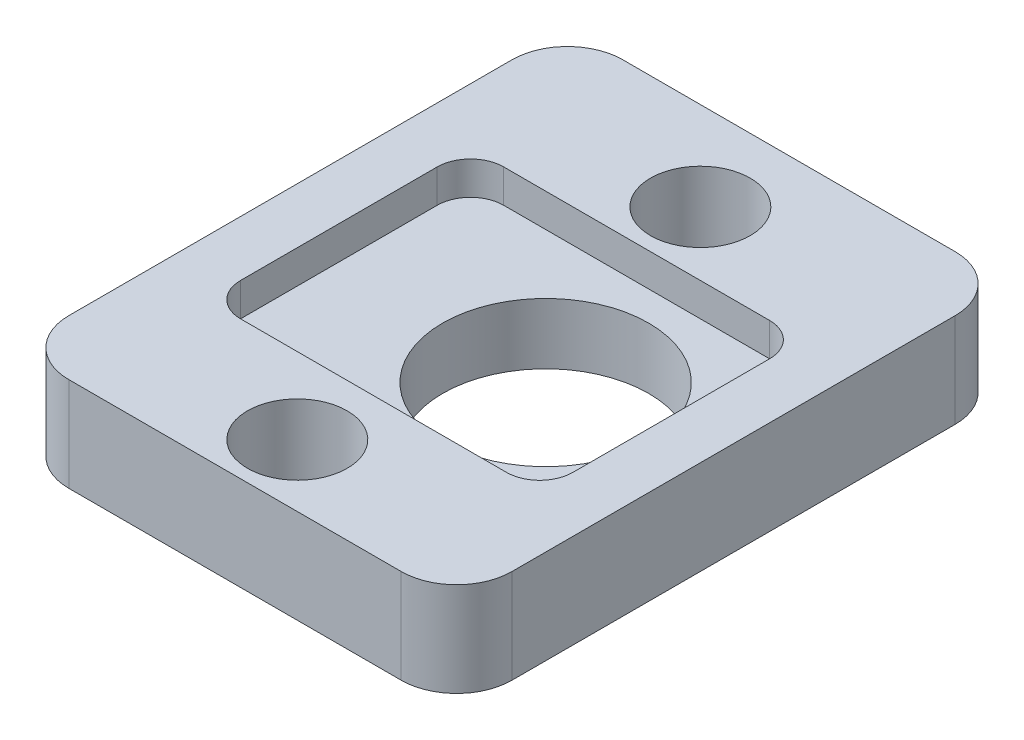
from build123d import *

# Parameters (mm, degrees)
BOSS_EXTRUDE1_DEPTH = 3.4
CUT_EXTRUDE1_DEPTH  = 1.2
SKETCH3_R           = 3.72
CUT_EXTRUDE2_DEPTH  = 26.706808437
SKETCH4_R           = 1.8
CUT_EXTRUDE3_DEPTH  = 26.837182509


with BuildPart() as part:
    # Sketch1 → Boss-Extrude1 (new body)
    with BuildSketch(Plane(origin=(0, 0, 0), x_dir=(1, 0, 0), z_dir=(0, 1, 0))):
        with BuildLine():
            Line((2, 0), (14, 0))
            ThreePointArc((14, 0), (15.414213562, -0.585786438), (16, -2))
            Line((16, -2), (16, -18))
            ThreePointArc((16, -18), (15.414213562, -19.414213562), (14, -20))
            Line((14, -20), (2, -20))
            ThreePointArc((2, -20), (0.585786438, -19.414213562), (0, -18))
            Line((0, -18), (0, -2))
            ThreePointArc((0, -2), (0.585786438, -0.585786438), (2, 0))
        make_face()
    extrude(amount=BOSS_EXTRUDE1_DEPTH)

    # Sketch2 → Cut-Extrude1 (cut)
    with BuildSketch(Plane(origin=(0, 3.4, 0), x_dir=(1, 0, 0), z_dir=(0, 1, 0))):
        with BuildLine():
            Line((3.2, -5.5), (12.8, -5.5))
            ThreePointArc((12.8, -5.5), (13.648528137, -5.851471863), (14, -6.7))
            Line((14, -6.7), (14, -13.8))
            ThreePointArc((14, -13.8), (13.648528137, -14.648528137), (12.8, -15))
            Line((12.8, -15), (3.2, -15))
            ThreePointArc((3.2, -15), (2.351471863, -14.648528137), (2, -13.8))
            Line((2, -13.8), (2, -6.7))
            ThreePointArc((2, -6.7), (2.351471863, -5.851471863), (3.2, -5.5))
        make_face()
    extrude(amount=-CUT_EXTRUDE1_DEPTH, mode=Mode.SUBTRACT)

    # Sketch3 → Cut-Extrude2 (cut, through all)
    with BuildSketch(Plane(origin=(0, 2.2, 0), x_dir=(1, 0, 0), z_dir=(0, 1, 0))):
        with Locations((9.5, -10.28537143)):
            Circle(SKETCH3_R)
    extrude(amount=-CUT_EXTRUDE2_DEPTH, mode=Mode.SUBTRACT)

    # Sketch4 → Cut-Extrude3 (cut, through all)
    with BuildSketch(Plane(origin=(0, 3.4, 0), x_dir=(1, 0, 0), z_dir=(0, 1, 0))):
        with Locations((8, -3.2)):
            Circle(SKETCH4_R)
        with Locations((8, -17.749813514)):
            Circle(SKETCH4_R)
    extrude(amount=-CUT_EXTRUDE3_DEPTH, mode=Mode.SUBTRACT)


solid = part.part
